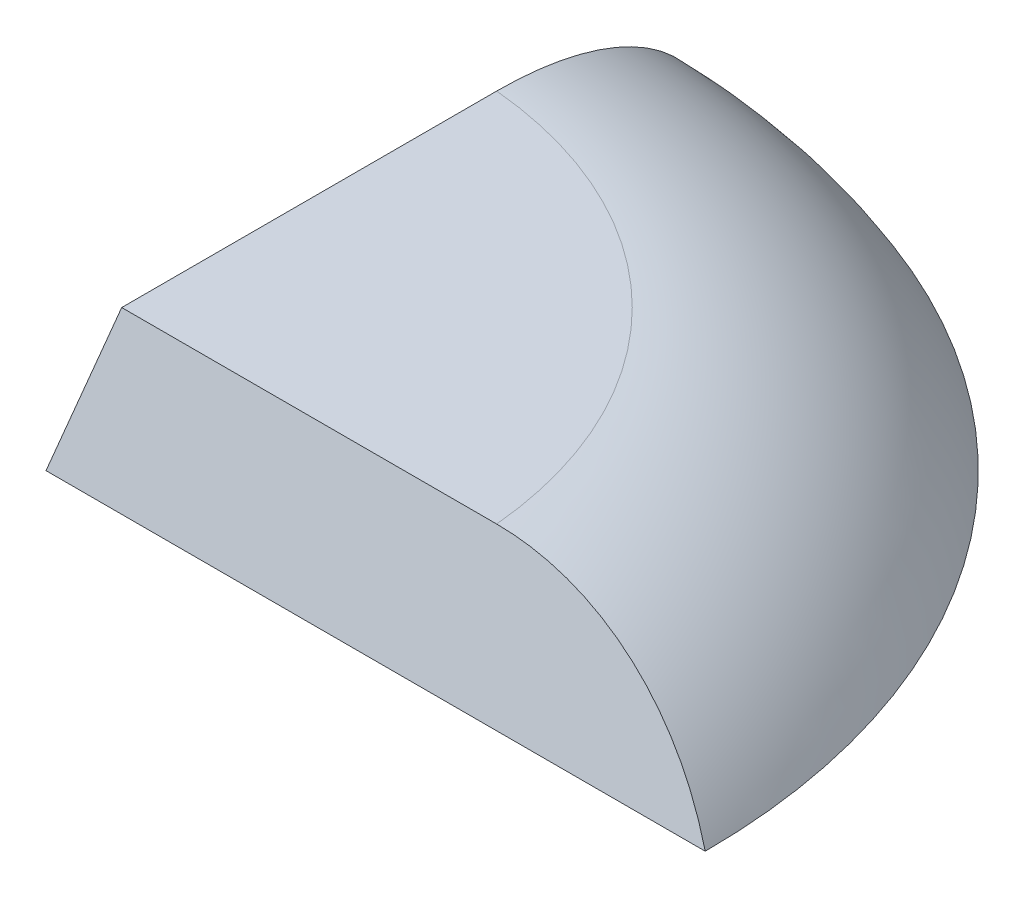
from build123d import *

# Parameters (mm, degrees)
BOSS_EXTRUDE1_DEPTH = 3
BOSS_EXTRUDE1_DRAFT = 15
FILLET1_R           = 6


with BuildPart() as part:
    # Sketch2 → Boss-Extrude1 (with draft: the straight prism first)
    with BuildSketch(Plane(origin=(0, 0, 0), x_dir=(1, 0, 0), z_dir=(0, 1, 0))):
        with BuildLine():
            Line((-17.044183736, -3.044183736), (-17.044183736, -17.044183736))
            Line((-17.044183736, -17.044183736), (-3.044183736, -17.044183736))
            ThreePointArc((-3.044183736, -17.044183736), (-7.144688799, -7.144688799), (-17.044183736, -3.044183736))
        make_face()
    extrude(amount=BOSS_EXTRUDE1_DEPTH)
    # Boss-Extrude1: the draft: its side faces are tilted about the plane it starts from
    boss_extrude1_sides = [part.faces().sort_by_distance(p)[0] for p in [
        (-17.044183736, 1.5, 10.044183736),
        (-10.044183736, 1.5, 17.044183736),
        (-7.144688799, 1.5, 7.144688799),
    ]]
    draft(boss_extrude1_sides, Plane(origin=(0, 0, 0), x_dir=(1, 0, 0), z_dir=(0, 1, 0)), BOSS_EXTRUDE1_DRAFT)

    # Fillet1
    # the kernel refuses this fillet: 6 mm, written as the material it takes off along each edge
    with BuildSketch(Plane(origin=(-17.044183736, 3, 17.044183736), x_dir=(0.7169006465944143, 0, 0.6971753458868941), z_dir=(-0.6971753458868941, 0, 0.7169006465944143))) as fillet1_piece_1:
        with BuildLine():
            CenterArc((8.803847577, -6), FILLET1_R, 30, 60)
            Line((8.803847577, 0), (8.803847577, 0.12))
            Line((8.803847577, 0.12), (13.196152423, 0.12))
            Line((13.196152423, 0.12), (13.312063522, 0.031058285))
            ThreePointArc((13.312063522, 0.031058285), (13.713987311, -1.468941715), (14.103923048, -2.94))
            Line((14.103923048, -2.94), (14, -3))
        make_face()
    revolve(axis=Axis((-17.044183736, 3, 17.044183736), (0, 1, 0)), revolution_arc=178.401637266, mode=Mode.SUBTRACT)


solid = part.part
